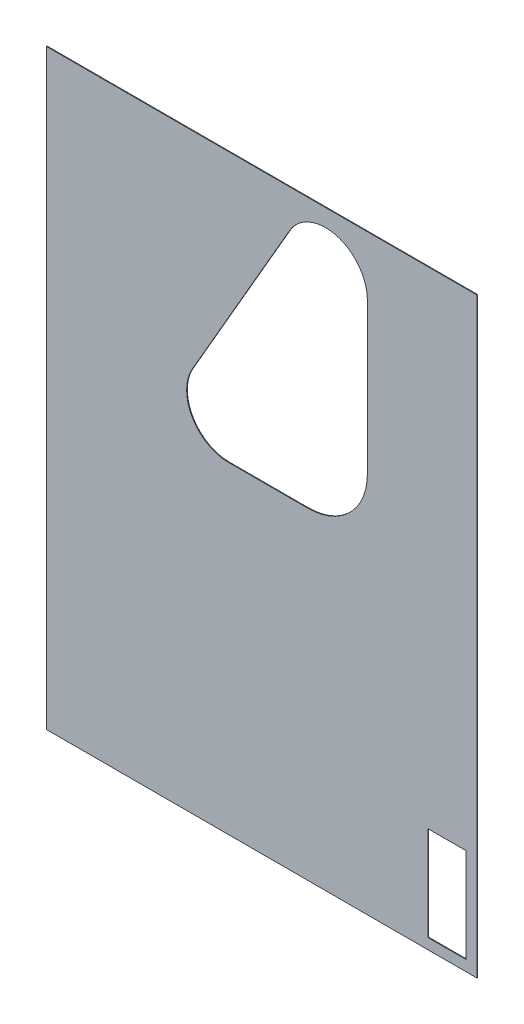
from build123d import *

# Parameters (mm, degrees)
SKETCH1_W           = 1215
SKETCH1_H           = 1670
SKETCH1_W_2         = 108.35
SKETCH1_H_2         = 266
BOSS_EXTRUDE1_DEPTH = 2
CUT_EXTRUDE1_DEPTH  = 2139.862174132


with BuildPart() as part:
    # Sketch1 → Boss-Extrude1 (new body)
    with BuildSketch(Plane.XY):
        with Locations((607.5, 835)):
            Rectangle(SKETCH1_W, SKETCH1_H)
        with Locations((1130.825, 163)):
            Rectangle(SKETCH1_W_2, SKETCH1_H_2, mode=Mode.SUBTRACT)
    extrude(amount=BOSS_EXTRUDE1_DEPTH)

    # Sketch2 → Cut-Extrude1 (cut, through all)
    with BuildSketch(Plane(origin=(-104.436638294, -13.071405931, 33), x_dir=(1, 0, 0), z_dir=(0, 0, 1))):
        with BuildLine():
            Line((1010.436638294, 1516.071405931), (1010.436638294, 1091.071405931))
            ThreePointArc((1010.436638294, 1091.071405931), (961.230577533, 972.277466691), (842.436638294, 923.071405931))
            Line((842.436638294, 923.071405931), (618.195260429, 923.071405931))
            ThreePointArc((618.195260429, 923.071405931), (516.004262782, 982.071405931), (516.004262782, 1100.071405931))
            Line((516.004262782, 1100.071405931), (790.245640647, 1575.071405931))
            ThreePointArc((790.245640647, 1575.071405931), (922.977285616, 1630.050653433), (1010.436638294, 1516.071405931))
        make_face()
    extrude(amount=-CUT_EXTRUDE1_DEPTH, mode=Mode.SUBTRACT)


solid = part.part
